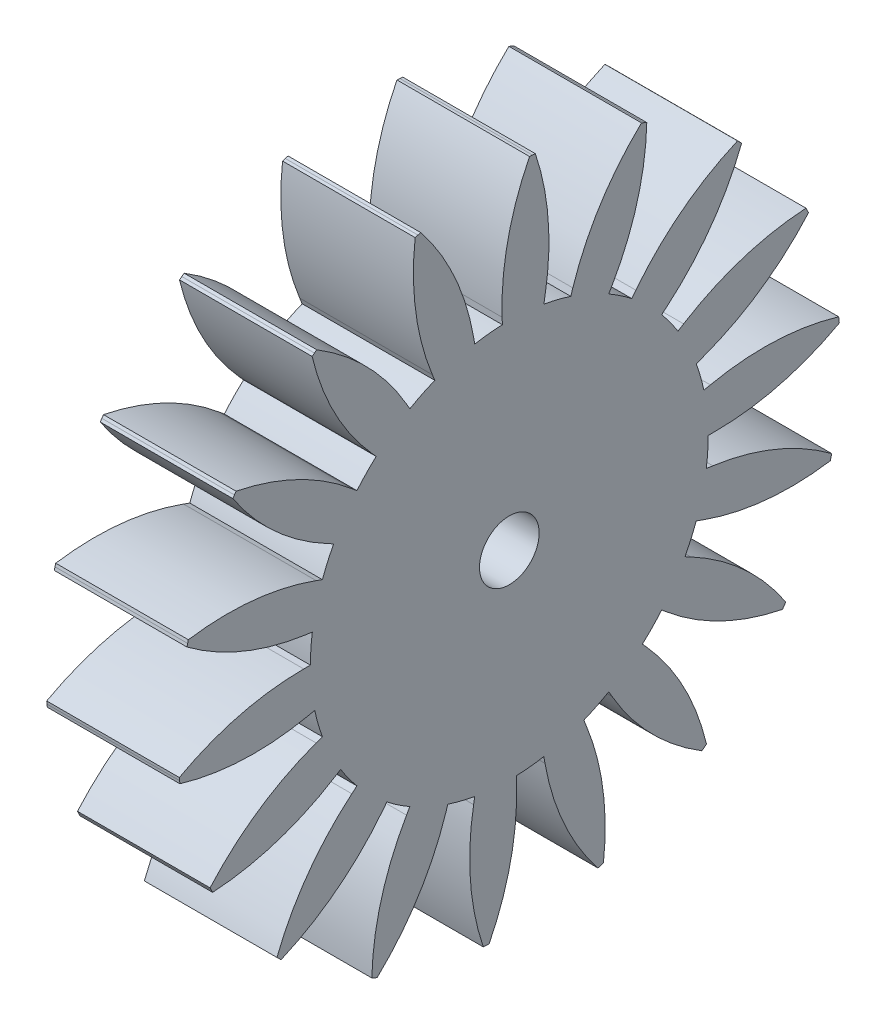
from build123d import *

# Parameters (mm, degrees)
SKETCH1_R           = 2.25
BOSS_EXTRUDE2_DEPTH = 10


with BuildPart() as part:
    # Sketch1 → Boss-Extrude2 (new body)
    with BuildSketch(Plane(origin=(0, 0, 0), x_dir=(0, 0, -1), z_dir=(1, 0, 0))):
        with BuildLine():
            Line((15.161287811, 3.222631208), (14.672214011, 3.118675362))
            ThreePointArc((14.672214011, 3.118675362), (14.418925439, 4.134560337), (14.095389312, 5.13030215))
            Line((14.095389312, 5.13030215), (14.565235622, 5.301312222))
            ThreePointArc((14.565235622, 5.301312222), (18.908034497, 7.529506054), (22.564632109, 10.76277742))
            Line((22.564632109, 10.76277742), (22.469851157, 10.95927867))
            Line((22.469851157, 10.95927867), (22.37335904, 11.154945328))
            ThreePointArc((22.37335904, 11.154945328), (17.574280154, 10.264107707), (13.14474549, 8.213748596))
            Line((13.14474549, 8.213748596), (12.720721442, 7.948788963))
            ThreePointArc((12.720721442, 7.948788963), (12.135254916, 8.816778784), (11.490666647, 9.641814145))
            Line((11.490666647, 9.641814145), (11.873688868, 9.96320795))
            ThreePointArc((11.873688868, 9.96320795), (15.19249775, 13.542349946), (17.522731607, 17.831261229))
            Line((17.522731607, 17.831261229), (17.366459261, 17.983495008))
            Line((17.366459261, 17.983495008), (17.208864392, 18.134359275))
            ThreePointArc((17.208864392, 18.134359275), (13.003889787, 15.655864088), (9.542752868, 12.214166681))
            Line((9.542752868, 12.214166681), (9.23492213, 11.820161304))
            ThreePointArc((9.23492213, 11.820161304), (8.387893552, 12.435563588), (7.5, 12.990381057))
            Line((7.5, 12.990381057), (7.75, 13.423393759))
            ThreePointArc((7.75, 13.423393759), (9.644521558, 17.92178657), (10.367331066, 22.749031772))
            Line((10.367331066, 22.749031772), (10.168416077, 22.838636441))
            Line((10.168416077, 22.838636441), (9.968726723, 22.92650186))
            ThreePointArc((9.968726723, 22.92650186), (6.865038395, 19.159292205), (4.789763413, 14.741376003))
            Line((4.789763413, 14.741376003), (4.635254916, 14.265847744))
            ThreePointArc((4.635254916, 14.265847744), (3.628828434, 14.554435894), (2.604722665, 14.772116295))
            Line((2.604722665, 14.772116295), (2.691546754, 15.264520172))
            ThreePointArc((2.691546754, 15.264520172), (2.933273727, 20.139591237), (1.961477393, 24.922933343))
            Line((1.961477393, 24.922933343), (1.743911844, 24.939101256))
            Line((1.743911844, 24.939101256), (1.526213488, 24.953369961))
            ThreePointArc((1.526213488, 24.953369961), (-0.101837945, 20.35182692), (-0.540942199, 15.490557819))
            Line((-0.540942199, 15.490557819), (-0.523492451, 14.990862405))
            ThreePointArc((-0.523492451, 14.990862405), (-1.567926949, 14.917828431), (-2.604722665, 14.772116295))
            Line((-2.604722665, 14.772116295), (-2.691546754, 15.264520172))
            ThreePointArc((-2.691546754, 15.264520172), (-4.131770205, 19.928263972), (-6.680959402, 24.09076133))
            Line((-6.680959402, 24.09076133), (-6.890933895, 24.031542398))
            Line((-6.890933895, 24.031542398), (-7.100383618, 23.970493372))
            ThreePointArc((-7.100383618, 23.970493372), (-7.056431125, 19.089630948), (-5.806402198, 14.371349746))
            Line((-5.806402198, 14.371349746), (-5.619098901, 13.907757819))
            ThreePointArc((-5.619098901, 13.907757819), (-6.575567202, 13.481910694), (-7.5, 12.990381057))
            Line((-7.5, 12.990381057), (-7.75, 13.423393759))
            ThreePointArc((-7.75, 13.423393759), (-10.698461672, 17.313293962), (-14.517573893, 20.352887959))
            Line((-14.517573893, 20.352887959), (-14.694631307, 20.225424859))
            Line((-14.694631307, 20.225424859), (-14.870569669, 20.096421515))
            ThreePointArc((-14.870569669, 20.096421515), (-13.15991457, 15.524943751), (-10.371524399, 11.518744795))
            Line((-10.371524399, 11.518744795), (-10.036959095, 11.147172382))
            ThreePointArc((-10.036959095, 11.147172382), (-10.790097005, 10.419875557), (-11.490666647, 9.641814145))
            Line((-11.490666647, 9.641814145), (-11.873688868, 9.96320795))
            ThreePointArc((-11.873688868, 9.96320795), (-15.974760769, 12.610085183), (-20.603154716, 14.160155923))
            Line((-20.603154716, 14.160155923), (-20.725939314, 13.979822587))
            Line((-20.725939314, 13.979822587), (-20.847145552, 13.798424633))
            ThreePointArc((-20.847145552, 13.798424633), (-17.676118098, 10.087719213), (-13.685687689, 7.276809223))
            Line((-13.685687689, 7.276809223), (-13.244213893, 7.042073442))
            ThreePointArc((-13.244213893, 7.042073442), (-13.703181865, 6.101049646), (-14.095389312, 5.13030215))
            Line((-14.095389312, 5.13030215), (-14.565235622, 5.301312222))
            ThreePointArc((-14.565235622, 5.301312222), (-19.324267955, 6.385914026), (-24.203691009, 6.259500101))
            Line((-24.203691009, 6.259500101), (-24.257393157, 6.04804739))
            Line((-24.257393157, 6.04804739), (-24.30924801, 5.836134096))
            ThreePointArc((-24.30924801, 5.836134096), (-20.060320912, 3.43376686), (-15.349155065, 2.157183065))
            Line((-15.349155065, 2.157183065), (-14.854021031, 2.087596514))
            ThreePointArc((-14.854021031, 2.087596514), (-14.963460754, 1.046347106), (-15, 0))
            Line((-15, 0), (-15.5, 0))
            ThreePointArc((-15.5, 0), (-20.34298323, -0.608492609), (-24.884904959, -2.396143813))
            Line((-24.884904959, -2.396143813), (-24.863047384, -2.613211582))
            Line((-24.863047384, -2.613211582), (-24.839296392, -2.830080344))
            ThreePointArc((-24.839296392, -2.830080344), (-20.024952965, -3.634348454), (-15.161287811, -3.222631208))
            Line((-15.161287811, -3.222631208), (-14.672214011, -3.118675362))
            ThreePointArc((-14.672214011, -3.118675362), (-14.418925439, -4.134560337), (-14.095389312, -5.13030215))
            Line((-14.095389312, -5.13030215), (-14.565235622, -5.301312222))
            ThreePointArc((-14.565235622, -5.301312222), (-18.908034497, -7.529506054), (-22.564632109, -10.76277742))
            Line((-22.564632109, -10.76277742), (-22.469851157, -10.95927867))
            Line((-22.469851157, -10.95927867), (-22.37335904, -11.154945328))
            ThreePointArc((-22.37335904, -11.154945328), (-17.574280154, -10.264107707), (-13.14474549, -8.213748596))
            Line((-13.14474549, -8.213748596), (-12.720721442, -7.948788963))
            ThreePointArc((-12.720721442, -7.948788963), (-12.135254916, -8.816778784), (-11.490666647, -9.641814145))
            Line((-11.490666647, -9.641814145), (-11.873688868, -9.96320795))
            ThreePointArc((-11.873688868, -9.96320795), (-15.19249775, -13.542349946), (-17.522731607, -17.831261229))
            Line((-17.522731607, -17.831261229), (-17.366459261, -17.983495008))
            Line((-17.366459261, -17.983495008), (-17.208864392, -18.134359275))
            ThreePointArc((-17.208864392, -18.134359275), (-13.003889787, -15.655864088), (-9.542752868, -12.214166681))
            Line((-9.542752868, -12.214166681), (-9.23492213, -11.820161304))
            ThreePointArc((-9.23492213, -11.820161304), (-8.387893552, -12.435563588), (-7.5, -12.990381057))
            Line((-7.5, -12.990381057), (-7.75, -13.423393759))
            ThreePointArc((-7.75, -13.423393759), (-9.644521558, -17.92178657), (-10.367331066, -22.749031772))
            Line((-10.367331066, -22.749031772), (-10.168416077, -22.838636441))
            Line((-10.168416077, -22.838636441), (-9.968726723, -22.92650186))
            ThreePointArc((-9.968726723, -22.92650186), (-6.865038395, -19.159292205), (-4.789763413, -14.741376003))
            Line((-4.789763413, -14.741376003), (-4.635254916, -14.265847744))
            ThreePointArc((-4.635254916, -14.265847744), (-3.628828434, -14.554435894), (-2.604722665, -14.772116295))
            Line((-2.604722665, -14.772116295), (-2.691546754, -15.264520172))
            ThreePointArc((-2.691546754, -15.264520172), (-2.933273727, -20.139591237), (-1.961477393, -24.922933343))
            Line((-1.961477393, -24.922933343), (-1.743911844, -24.939101256))
            Line((-1.743911844, -24.939101256), (-1.526213488, -24.953369961))
            ThreePointArc((-1.526213488, -24.953369961), (0.101837945, -20.35182692), (0.540942199, -15.490557819))
            Line((0.540942199, -15.490557819), (0.523492451, -14.990862405))
            ThreePointArc((0.523492451, -14.990862405), (1.567926949, -14.917828431), (2.604722665, -14.772116295))
            Line((2.604722665, -14.772116295), (2.691546754, -15.264520172))
            ThreePointArc((2.691546754, -15.264520172), (4.131770205, -19.928263972), (6.680959402, -24.09076133))
            Line((6.680959402, -24.09076133), (6.890933895, -24.031542398))
            Line((6.890933895, -24.031542398), (7.100383618, -23.970493372))
            ThreePointArc((7.100383618, -23.970493372), (7.056431125, -19.089630948), (5.806402198, -14.371349746))
            Line((5.806402198, -14.371349746), (5.619098901, -13.907757819))
            ThreePointArc((5.619098901, -13.907757819), (6.575567202, -13.481910694), (7.5, -12.990381057))
            Line((7.5, -12.990381057), (7.75, -13.423393759))
            ThreePointArc((7.75, -13.423393759), (10.698461672, -17.313293962), (14.517573893, -20.352887959))
            Line((14.517573893, -20.352887959), (14.694631307, -20.225424859))
            Line((14.694631307, -20.225424859), (14.870569669, -20.096421515))
            ThreePointArc((14.870569669, -20.096421515), (13.15991457, -15.524943751), (10.371524399, -11.518744795))
            Line((10.371524399, -11.518744795), (10.036959095, -11.147172382))
            ThreePointArc((10.036959095, -11.147172382), (10.790097005, -10.419875557), (11.490666647, -9.641814145))
            Line((11.490666647, -9.641814145), (11.873688868, -9.96320795))
            ThreePointArc((11.873688868, -9.96320795), (15.974760769, -12.610085183), (20.603154716, -14.160155923))
            Line((20.603154716, -14.160155923), (20.725939314, -13.979822587))
            Line((20.725939314, -13.979822587), (20.847145552, -13.798424633))
            ThreePointArc((20.847145552, -13.798424633), (17.676118098, -10.087719213), (13.685687689, -7.276809223))
            Line((13.685687689, -7.276809223), (13.244213893, -7.042073442))
            ThreePointArc((13.244213893, -7.042073442), (13.703181865, -6.101049646), (14.095389312, -5.13030215))
            Line((14.095389312, -5.13030215), (14.565235622, -5.301312222))
            ThreePointArc((14.565235622, -5.301312222), (19.324267955, -6.385914026), (24.203691009, -6.259500101))
            Line((24.203691009, -6.259500101), (24.257393157, -6.04804739))
            Line((24.257393157, -6.04804739), (24.30924801, -5.836134096))
            ThreePointArc((24.30924801, -5.836134096), (20.060320912, -3.43376686), (15.349155065, -2.157183065))
            Line((15.349155065, -2.157183065), (14.854021031, -2.087596514))
            ThreePointArc((14.854021031, -2.087596514), (14.963460754, -1.046347106), (15, 0))
            Line((15, 0), (15.5, 0))
            ThreePointArc((15.5, 0), (20.34298323, 0.608492609), (24.884904959, 2.396143813))
            Line((24.884904959, 2.396143813), (24.863047384, 2.613211582))
            Line((24.863047384, 2.613211582), (24.839296392, 2.830080344))
            ThreePointArc((24.839296392, 2.830080344), (20.024952965, 3.634348454), (15.161287811, 3.222631208))
        make_face()
        Circle(SKETCH1_R, mode=Mode.SUBTRACT)
    extrude(amount=BOSS_EXTRUDE2_DEPTH)


solid = part.part
